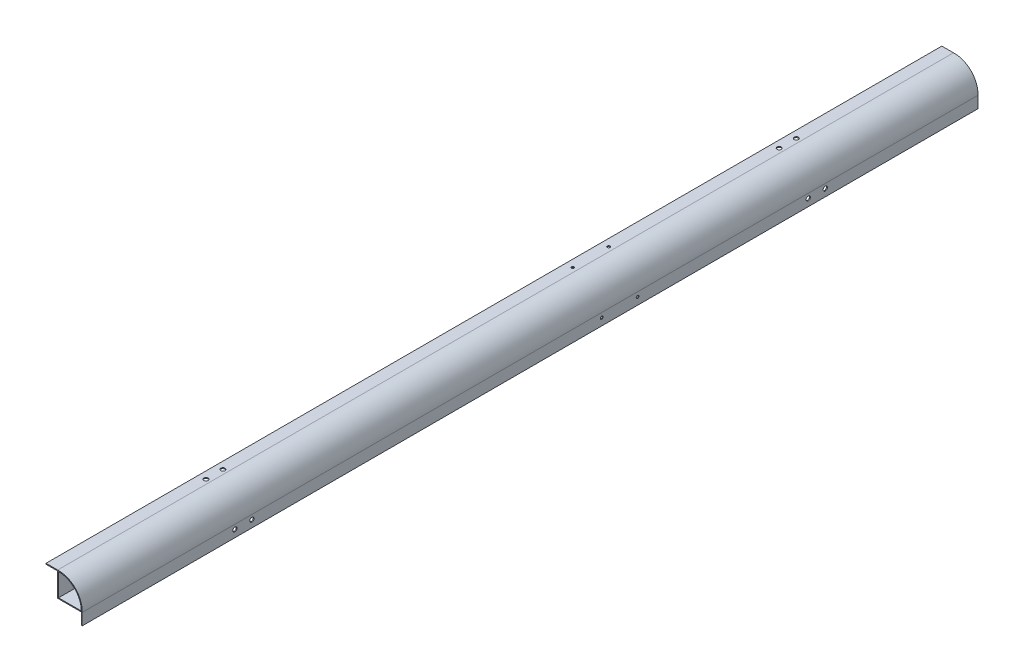
from build123d import *

# Parameters (mm, degrees)
SALIENTE_EXTRUIR1_DEPTH = 500
CROQUIS2_R              = 2.38125
CROQUIS2_R_2            = 1.5
CORTAR_EXTRUIR1_DEPTH   = 10
CROQUIS3_R              = 2.38125
CROQUIS3_R_2            = 1.5
CORTAR_EXTRUIR2_DEPTH   = 10


with BuildPart() as part:
    # Croquis1 → Saliente-Extruir1 (new, symmetric)
    with BuildSketch(Plane.XY):
        with BuildLine():
            Line((-13.7, 12.681053808), (-13.7, -13.7))
            Line((-13.7, -13.7), (12.681053808, -13.7))
            Line((12.681053808, -13.7), (12.681053808, -26.7))
            Line((12.681053808, -26.7), (13.681053808, -26.7))
            Line((13.681053808, -26.7), (13.681053808, -13.7))
            ThreePointArc((13.681053808, -13.7), (5.967619023, 5.967619023), (-13.7, 13.681053808))
            Line((-13.7, 13.681053808), (-26.7, 13.681053808))
            Line((-26.7, 13.681053808), (-26.7, 12.681053808))
            Line((-26.7, 12.681053808), (-13.7, 12.681053808))
        make_face()
        with BuildLine():
            Line((12.7, -12.7), (-12.7, -12.7))
            Line((-12.7, -12.7), (-12.7, 12.7))
            ThreePointArc((-12.7, 12.7), (5.260512242, 5.260512242), (12.7, -12.7))
        make_face(mode=Mode.SUBTRACT)
    extrude(amount=SALIENTE_EXTRUIR1_DEPTH, both=True)

    # Croquis2 → Cortar-Extruir1 (cut)
    with BuildSketch(Plane(origin=(13.681053808, 0, 0), x_dir=(0, 0, -1), z_dir=(1, 0, 0))):
        with Locations((310.5, -18.7)):
            Circle(CROQUIS2_R)
        with Locations((329.5, -18.7)):
            Circle(CROQUIS2_R)
        with Locations((-329.5, -18.7)):
            Circle(CROQUIS2_R)
        with Locations((-310.5, -18.7)):
            Circle(CROQUIS2_R)
        with Locations((120, -18.7)):
            Circle(CROQUIS2_R_2)
        with Locations((80, -18.7)):
            Circle(CROQUIS2_R_2)
    extrude(amount=-CORTAR_EXTRUIR1_DEPTH, mode=Mode.SUBTRACT)

    # Croquis3 → Cortar-Extruir2 (cut)
    with BuildSketch(Plane(origin=(0, 13.681053808, 0), x_dir=(1, 0, 0), z_dir=(0, 1, 0))):
        with Locations((-18.7, 329.5)):
            Circle(CROQUIS3_R)
        with Locations((-18.7, 310.5)):
            Circle(CROQUIS3_R)
        with Locations((-18.7, -310.5)):
            Circle(CROQUIS3_R)
        with Locations((-18.7, -329.5)):
            Circle(CROQUIS3_R)
        with Locations((-18.7, 120)):
            Circle(CROQUIS3_R_2)
        with Locations((-18.7, 80)):
            Circle(CROQUIS3_R_2)
    extrude(amount=-CORTAR_EXTRUIR2_DEPTH, mode=Mode.SUBTRACT)


solid = part.part
